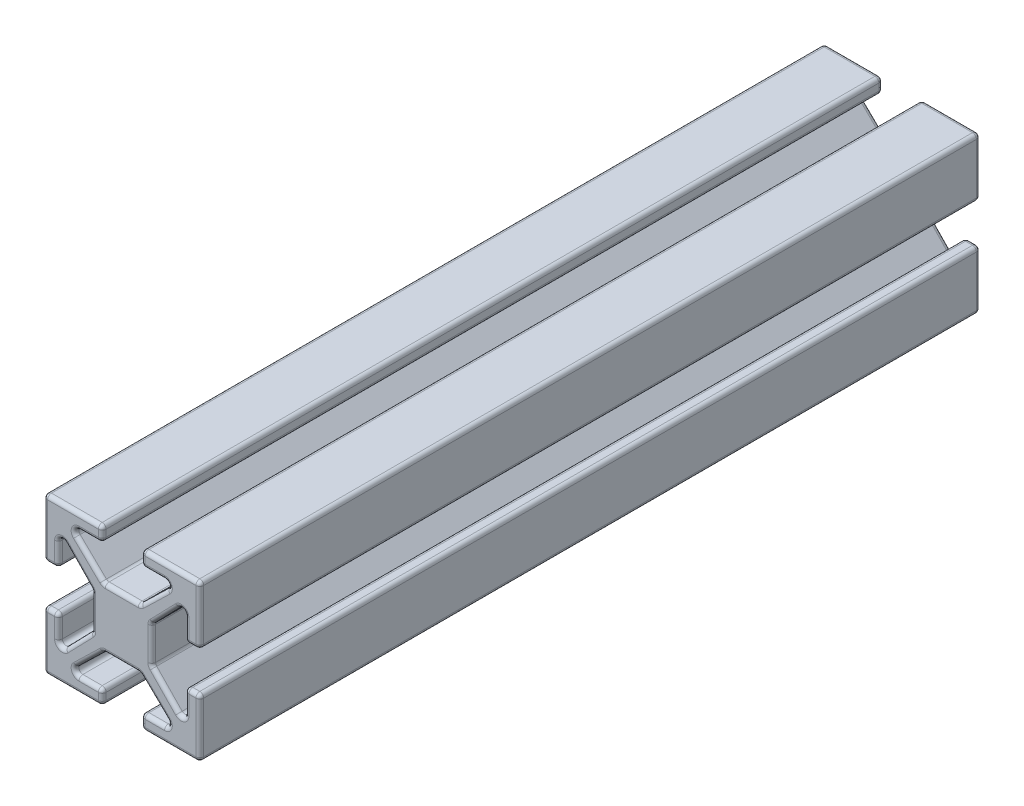
from build123d import *

# Parameters (mm, degrees)
BOSS_EXTRUDE1_DEPTH = 200
FILLET3_R           = 1


with BuildPart() as part:
    # Sketch1 → Boss-Extrude1 (new body)
    with BuildSketch(Plane.XY):
        Polygon((-5, 16.212568099), (-5, 20), (-20, 20), (-20, 5), (-16.212568099, 5), (-16.212568099, 13.432263719), (-7.689389441, 4.631155322), (-7.689389441, 0), (-7.689389441, -4.631155322), (-16.212568099, -13.432263719), (-16.212568099, -5), (-20, -5), (-20, -20), (-5, -20), (-5, -16.212568099), (-13.432263719, -16.212568099), (-4.631155322, -7.689389441), (0, -7.689389441), (4.631155322, -7.689389441), (13.432263719, -16.212568099), (5, -16.212568099), (5, -20), (20, -20), (20, -5), (16.212568099, -5), (16.212568099, -13.432263719), (7.689389441, -4.631155322), (7.689389441, 0), (7.689389441, 4.631155322), (16.212568099, 13.432263719), (16.212568099, 5), (20, 5), (20, 20), (5, 20), (5, 16.212568099), (13.432263719, 16.212568099), (4.631155322, 7.689389441), (0, 7.689389441), (-4.631155322, 7.689389441), (-13.432263719, 16.212568099), align=None)
    extrude(amount=BOSS_EXTRUDE1_DEPTH)

    # Fillet3
    fillet3_edges = [part.edges().sort_by_distance(p)[0] for p in [
        (-9.03170952, -11.95097877, 0),
        (0, -7.689389441, 0),
        (9.031709521, -11.95097877, 0),
        (9.216131859, -16.212568099, 0),
        (5, -18.10628405, 0),
        (12.5, -20, 0),
        (20, -12.5, 0),
        (18.10628405, -5, 0),
        (16.212568099, -9.216131859, 0),
        (11.95097877, -9.03170952, 0),
        (7.689389441, 0, 0),
        (11.95097877, 9.03170952, 0),
        (16.212568099, 9.216131859, 0),
        (18.10628405, 5, 0),
        (20, 12.5, 0),
        (5, 18.10628405, 0),
        (9.216131859, 16.212568099, 0),
        (9.03170952, 11.95097877, 0),
        (0, 7.689389441, 0),
        (-9.03170952, 11.95097877, 0),
        (-9.216131859, 16.212568099, 0),
        (-5, 18.10628405, 0),
        (-12.5, 20, 0),
        (-20, 12.5, 0),
        (-18.10628405, 5, 0),
        (-16.212568099, 9.216131859, 0),
        (-11.95097877, 9.03170952, 0),
        (-7.689389441, 0, 0),
        (-11.95097877, -9.03170952, 0),
        (-16.212568099, -9.216131859, 0),
        (-18.10628405, -5, 0),
        (-20, -12.5, 0),
        (-12.5, -20, 0),
        (-5, -18.10628405, 0),
        (-9.216131859, -16.212568099, 0),
        (-9.03170952, -11.95097877, 200),
        (0, -7.689389441, 200),
        (9.031709521, -11.95097877, 200),
        (9.216131859, -16.212568099, 200),
        (5, -18.10628405, 200),
        (12.5, -20, 200),
        (20, -12.5, 200),
        (18.10628405, -5, 200),
        (16.212568099, -9.216131859, 200),
        (11.95097877, -9.03170952, 200),
        (7.689389441, 0, 200),
        (11.95097877, 9.03170952, 200),
        (16.212568099, 9.216131859, 200),
        (18.10628405, 5, 200),
        (20, 12.5, 200),
        (12.5, 20, 200),
        (5, 18.10628405, 200),
        (9.216131859, 16.212568099, 200),
        (9.03170952, 11.95097877, 200),
        (0, 7.689389441, 200),
        (-9.03170952, 11.95097877, 200),
        (-9.216131859, 16.212568099, 200),
        (-5, 18.10628405, 200),
        (-12.5, 20, 200),
        (-20, 12.5, 200),
        (-18.10628405, 5, 200),
        (-16.212568099, 9.216131859, 200),
        (-11.95097877, 9.03170952, 200),
        (-7.689389441, 0, 200),
        (-11.95097877, -9.03170952, 200),
        (-16.212568099, -9.216131859, 200),
        (-18.10628405, -5, 200),
        (-20, -12.5, 200),
        (-12.5, -20, 200),
        (-5, -18.10628405, 200),
        (-9.216131859, -16.212568099, 200),
        (-13.432263719, -16.212568099, 100),
        (-5, -16.212568099, 100),
        (-5, -20, 100),
        (-20, -20, 100),
        (-20, -5, 100),
        (-16.212568099, -5, 100),
        (-16.212568099, -13.432263719, 100),
        (-7.689389441, -4.631155322, 100),
        (-7.689389441, 4.631155322, 100),
        (-16.212568099, 13.432263719, 100),
        (-16.212568099, 5, 100),
        (-20, 5, 100),
        (-20, 20, 100),
        (-5, 20, 100),
        (-5, 16.212568099, 100),
        (-13.432263719, 16.212568099, 100),
        (-4.631155322, 7.689389441, 100),
        (4.631155322, 7.689389441, 100),
        (13.432263719, 16.212568099, 100),
        (5, 16.212568099, 100),
        (5, 20, 100),
        (20, 20, 100),
        (20, 5, 100),
        (16.212568099, 5, 100),
        (16.212568099, 13.432263719, 100),
        (7.689389441, 4.631155322, 100),
        (7.689389441, -4.631155322, 100),
        (16.212568099, -13.432263719, 100),
        (16.212568099, -5, 100),
        (20, -5, 100),
        (20, -20, 100),
        (5, -20, 100),
        (5, -16.212568099, 100),
        (13.432263719, -16.212568099, 100),
        (4.631155322, -7.689389441, 100),
        (-4.631155322, -7.689389441, 100),
        (12.5, 20, 0),
    ]]
    fillet(fillet3_edges, radius=FILLET3_R)


solid = part.part
